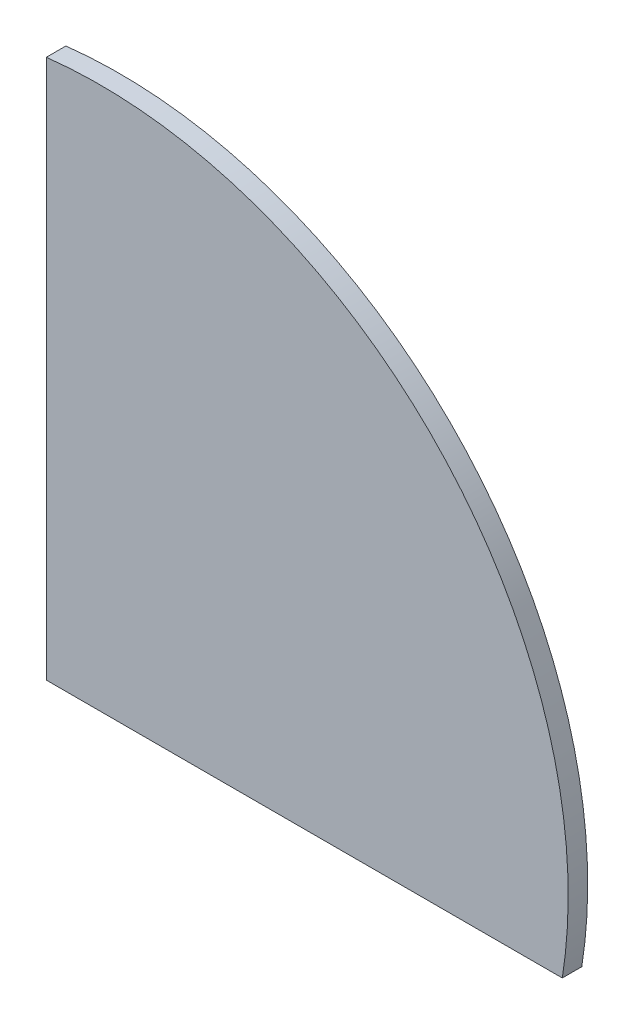
from build123d import *
from build123d.topology import SkipClean

# Parameters (mm, degrees)
SKETCH1_R           = 240
BOSS_EXTRUDE1_DEPTH = 10
BOSS_EXTRUDE2_START = 102.52
SKETCH2_R           = 240
SKETCH2_R_2         = 230
BOSS_EXTRUDE2_DEPTH = 102.52
CUT_EXTRUDE1_START  = -112.52
CUT_EXTRUDE1_DEPTH  = 112.52
BOSS_EXTRUDE4_START = 6
BOSS_EXTRUDE4_DEPTH = 6
CUT_EXTRUDE2_DEPTH  = 348.598906788
BOSS_EXTRUDE6_START = 10
BOSS_EXTRUDE6_DEPTH = 10
CUT_EXTRUDE3_START  = -118.52
CUT_EXTRUDE3_DEPTH  = 118.52


# Read off the part's stored shape, not the designer's step: Cut-Extrude1
with BuildPart() as part:
    # Sketch1 → Boss-Extrude1 (new body)
    with BuildSketch(Plane.XY.offset(65)):
        Circle(SKETCH1_R)
    extrude(amount=BOSS_EXTRUDE1_DEPTH)

    # Sketch2 → Boss-Extrude2 (add)
    with BuildSketch(Plane(origin=(0, 0, 65), x_dir=(-1, 0, 0), z_dir=(0, 0, -1)).offset(BOSS_EXTRUDE2_START)):
        Circle(SKETCH2_R)
        Circle(SKETCH2_R_2, mode=Mode.SUBTRACT)
    extrude(amount=-BOSS_EXTRUDE2_DEPTH)

    # Cut-Extrude1 outline → Cut-Extrude1 (cut)
    with BuildSketch(Plane(origin=(0, 0, -37.52), x_dir=(-1, 0, 0), z_dir=(0, 0, -1)).offset(CUT_EXTRUDE1_START)):
        with BuildLine():
            ThreePointArc((-87.384683401, -223.526099386), (232.916203487, -57.879548662), (27.411033925, 238.429518347))
            Line((27.411033925, 238.429518347), (27.411033925, -223.526099386))
            Line((27.411033925, -223.526099386), (-87.384683401, -223.526099386))
        make_face()
    extrude(amount=CUT_EXTRUDE1_DEPTH, mode=Mode.SUBTRACT)

    # Sketch5 → Boss-Extrude4 (add)
    with SkipClean():  # the faces are left unmerged after this step: merging them gives an invalid solid
        with BuildSketch(Plane(origin=(0, 0, -37.52), x_dir=(-1, 0, 0), z_dir=(0, 0, -1)).offset(BOSS_EXTRUDE4_START)):
            with BuildLine():
                Line((27.411033925, 228.360756741), (27.411033925, 238.429518347))
                ThreePointArc((27.411033925, 238.429518347), (-173.515297538, 165.808448277), (-236.939158864, -38.207787126))
                Line((-236.939158864, -38.207787126), (-226.804243794, -38.207787126))
                ThreePointArc((-226.804243794, -38.207787126), (-166.445517153, 158.732132285), (27.411033925, 228.360756741))
            make_face()
        extrude(amount=-BOSS_EXTRUDE4_DEPTH)

    # Sketch7 → Cut-Extrude2 (cut, through all)
    with SkipClean():  # the faces are left unmerged after this step: merging them gives an invalid solid
        with BuildSketch(Plane(origin=(0, 0, 0), x_dir=(0, 0, -1), z_dir=(1, 0, 0))):
            Polygon((-26.398, -50.207787126), (37.52, -50.207787126), (43.52, -50.207787126), (43.52, -37.967787126), (-27.418, -37.967787126), (-27.418, -49.187787126), (-27.418, -50.207787126), align=None)
        extrude(amount=CUT_EXTRUDE2_DEPTH, mode=Mode.SUBTRACT)

    # Sketch9 → Boss-Extrude6 (add)
    with SkipClean():  # the faces are left unmerged after this step: merging them gives an invalid solid
        with BuildSketch(Plane(origin=(0, 0, -43.52), x_dir=(-1, 0, 0), z_dir=(0, 0, -1)).offset(BOSS_EXTRUDE6_START)):
            with BuildLine():
                Line((-226.844543996, -37.967787126), (-236.977735538, -37.967787126))
                ThreePointArc((-236.977735538, -37.967787126), (-173.431306933, 165.896298258), (27.411033925, 238.429518347))
                Line((27.411033925, 238.429518347), (27.411033925, -37.967787126))
                Line((27.411033925, -37.967787126), (-226.844543996, -37.967787126))
            make_face()
        extrude(amount=-BOSS_EXTRUDE6_DEPTH)

    # Sketch10 → Cut-Extrude3 (cut)
    with BuildSketch(Plane.XY.offset(75).offset(CUT_EXTRUDE3_START)):
        with BuildLine():
            Line((-27.411033925, 238.429518347), (-27.411033925, -223.526099386))
            Line((-27.411033925, -223.526099386), (87.384683401, -223.526099386))
            ThreePointArc((87.384683401, -223.526099386), (232.916203487, 57.879548662), (-27.411033925, 238.429518347))
        make_face()
    extrude(amount=CUT_EXTRUDE3_DEPTH, mode=Mode.SUBTRACT)


solid = part.part
